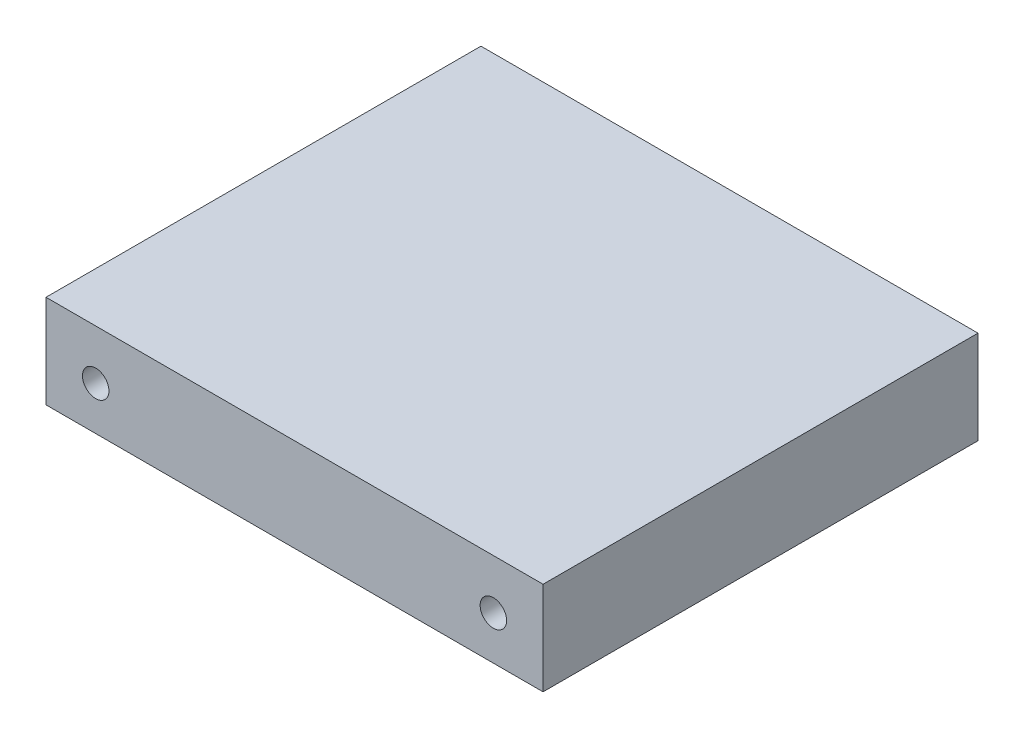
from build123d import *

# Parameters (mm, degrees)
SKETCH2_W                 = 50.8
SKETCH2_H                 = 44.45
BOSS_EXTRUDE1_DEPTH       = 9.525
F_6_32_TAPPED_HOLE1_D     = 2.7051
F_6_32_TAPPED_HOLE1_DEPTH = 9.398
F_6_32_TAPPED_HOLE1_TIP   = 0.81269403
F_6_32_TAPPED_HOLE2_D     = 2.7051
F_6_32_TAPPED_HOLE2_DEPTH = 9.398
F_6_32_TAPPED_HOLE2_TIP   = 0.81269403


with BuildPart() as part:
    # Sketch2 → Boss-Extrude1 (new body)
    with BuildSketch(Plane(origin=(0, 0, 0), x_dir=(1, 0, 0), z_dir=(0, 1, 0))):
        Rectangle(SKETCH2_W, SKETCH2_H)
    extrude(amount=BOSS_EXTRUDE1_DEPTH)

    # #6-32 Tapped Hole1
    with Locations(Plane.XY.offset(22.225)):
        with Locations((-20.32, 4.445), (20.32, 4.445)):
            Hole(F_6_32_TAPPED_HOLE1_D / 2, depth=F_6_32_TAPPED_HOLE1_DEPTH)
            with Locations((0, 0, -(F_6_32_TAPPED_HOLE1_DEPTH + F_6_32_TAPPED_HOLE1_TIP / 2))):  # 118° drill point
                Cone(0, F_6_32_TAPPED_HOLE1_D / 2, F_6_32_TAPPED_HOLE1_TIP, mode=Mode.SUBTRACT)

    # #6-32 Tapped Hole2
    with Locations(Plane(origin=(0, 0, -22.225), x_dir=(-1, 0, 0), z_dir=(0, 0, -1))):
        with Locations((-20.32, 4.445), (20.32, 4.445)):
            Hole(F_6_32_TAPPED_HOLE2_D / 2, depth=F_6_32_TAPPED_HOLE2_DEPTH)
            with Locations((0, 0, -(F_6_32_TAPPED_HOLE2_DEPTH + F_6_32_TAPPED_HOLE2_TIP / 2))):  # 118° drill point
                Cone(0, F_6_32_TAPPED_HOLE2_D / 2, F_6_32_TAPPED_HOLE2_TIP, mode=Mode.SUBTRACT)


solid = part.part
